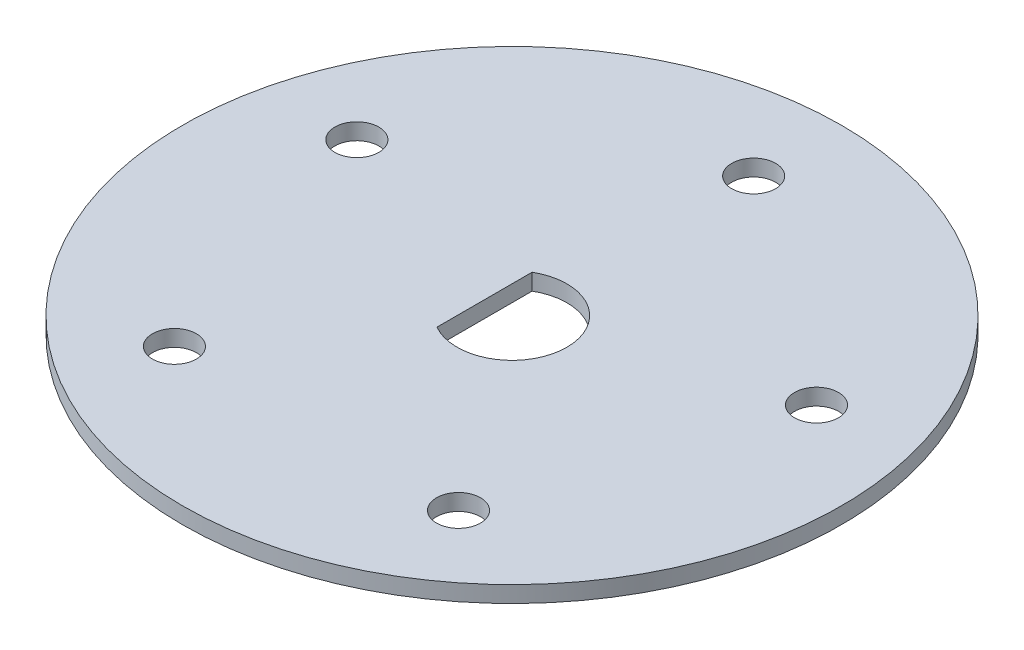
from build123d import *

# Parameters (mm, degrees)
SKETCH1_R           = 38.1
SKETCH1_R_2         = 2.54
BOSS_EXTRUDE1_DEPTH = 1.89738


with BuildPart() as part:
    # Sketch1 → Boss-Extrude1 (new body)
    with BuildSketch(Plane(origin=(0, 0, 0), x_dir=(1, 0, 0), z_dir=(0, 1, 0))):
        Circle(SKETCH1_R)
        with Locations((0, 27.94)):
            Circle(SKETCH1_R_2, mode=Mode.SUBTRACT)
        with Locations((26.572519065, 8.633934823)):
            Circle(SKETCH1_R_2, mode=Mode.SUBTRACT)
        with Locations((16.422719949, -22.603934823)):
            Circle(SKETCH1_R_2, mode=Mode.SUBTRACT)
        with Locations((-16.422719949, -22.603934823)):
            Circle(SKETCH1_R_2, mode=Mode.SUBTRACT)
        with Locations((-26.572519065, 8.633934823)):
            Circle(SKETCH1_R_2, mode=Mode.SUBTRACT)
        with BuildLine():
            Line((-3.175, 5.499261314), (-3.175, -5.499261314))
            ThreePointArc((-3.175, -5.499261314), (6.35, 0), (-3.175, 5.499261314))
        make_face(mode=Mode.SUBTRACT)
    extrude(amount=BOSS_EXTRUDE1_DEPTH)


solid = part.part
